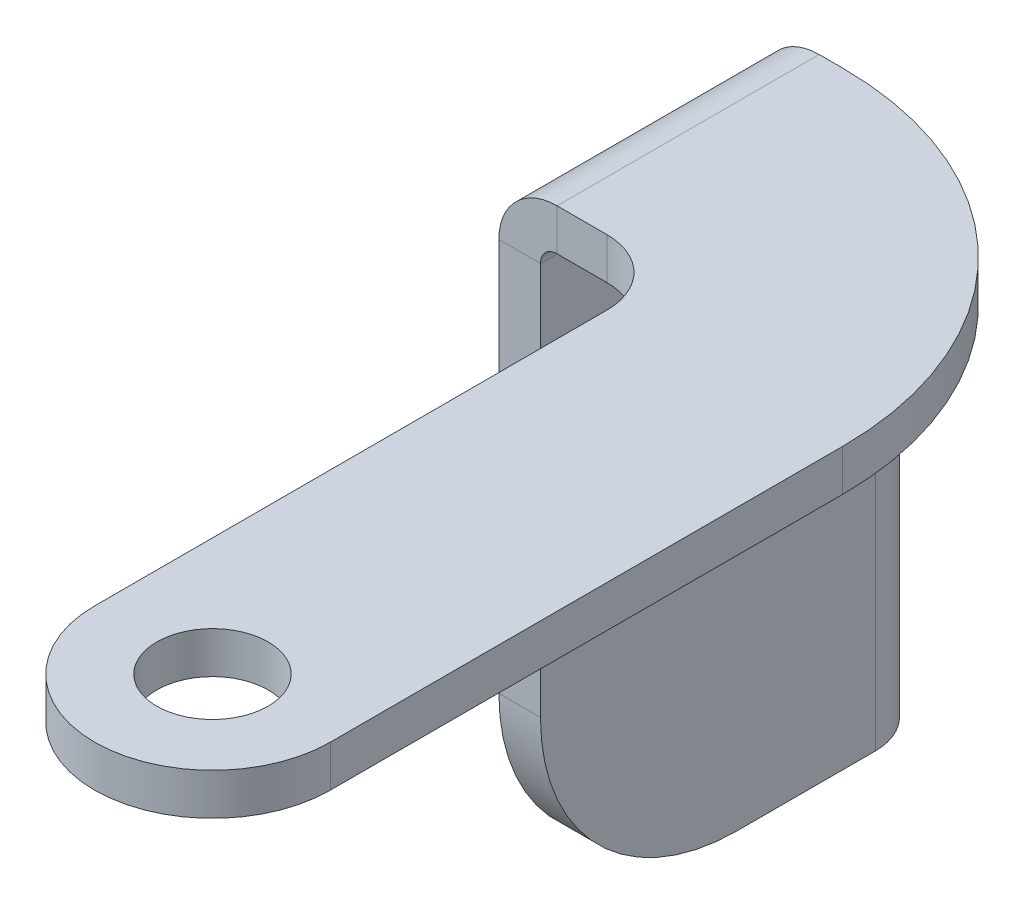
from build123d import *

# Parameters (mm, degrees)
SKETCH1_R                    = 4.25
BASE_FLANGE1_DEPTH           = 3.175
EDGE_FLANGE1_DEPTH           = 20
EDGE_FLANGE1_START           = 3.175
EDGE_FLANGE1_FLAT_DEPTH      = 3.175
EDGE_FLANGE3_STRIP_W         = 15.24
EDGE_FLANGE3_STRIP_H         = 3.175
EDGE_FLANGE3_STRIP_CUT_DEPTH = 20
EDGE_FLANGE3_DEPTH           = 20
EDGE_FLANGE3_START           = -3.175
EDGE_FLANGE3_PROFILE_R       = 4.25
EDGE_FLANGE3_FLAT_DEPTH      = 3.175


# Sheet-metal steps are written as plain solids
with BuildPart() as part:
    # Sketch1 → Base-Flange1 (new body)
    with BuildSketch(Plane.XY):
        with BuildLine():
            Line((12.5, 10), (0, 10))
            ThreePointArc((0, 10), (-10, 0), (0, -10))
            Line((0, -10), (12.5, -10))
            Line((12.5, -10), (12.5, 10))
        make_face()
        Circle(SKETCH1_R, mode=Mode.SUBTRACT)
    extrude(amount=-BASE_FLANGE1_DEPTH)

    # Edge-Flange1 bend section (across the edge) → Edge-Flange1 (add)
    with BuildSketch(Plane(origin=(13.77, -10, 0), x_dir=(-1, 0, 0), z_dir=(0, 1, 0))):
        with BuildLine():
            Line((-3.175, 1.27), (0, 1.27))
            ThreePointArc((0, 1.27), (0.371974388, 0.371974388), (1.27, 0))
            Line((1.27, 0), (1.27, -3.175))
            ThreePointArc((1.27, -3.175), (-1.873089642, -1.873089642), (-3.175, 1.27))
        make_face()
    extrude(amount=EDGE_FLANGE1_DEPTH)

    # Edge-Flange1 profile (on flange) → Edge-Flange1 flat (add)
    with BuildSketch(Plane.YZ.offset(13.77).offset(EDGE_FLANGE1_START)):
        with BuildLine():
            Line((36.2752, 26.825), (5, 26.825))
            ThreePointArc((5, 26.825), (-5.606601718, 22.431601718), (-10, 11.825))
            Line((-10, 11.825), (-10, 1.27))
            Line((-10, 1.27), (10, 1.27))
            Line((10, 1.27), (10, 1.825))
            ThreePointArc((10, 1.825), (11.464466094, 5.360533906), (15, 6.825))
            Line((15, 6.825), (36.2752, 6.825))
            Line((36.2752, 6.825), (36.2752, 26.825))
        make_face()
    extrude(amount=-EDGE_FLANGE1_FLAT_DEPTH)

    # Edge-Flange3 strip (across the edge) → Edge-Flange3 strip cut (cut)
    with BuildSketch(Plane(origin=(16.945, 36.2752, 6.825), x_dir=(0, -1, 0), z_dir=(0, 0, 1))):
        with Locations((-6.35, -1.5875)):
            Rectangle(EDGE_FLANGE3_STRIP_W, EDGE_FLANGE3_STRIP_H)
    extrude(amount=EDGE_FLANGE3_STRIP_CUT_DEPTH, mode=Mode.SUBTRACT)

    # Edge-Flange3 bend section (across the edge) → Edge-Flange3 (add)
    with BuildSketch(Plane(origin=(16.945, 36.2752, 6.825), x_dir=(0, -1, 0), z_dir=(0, 0, 1))):
        with BuildLine():
            Line((-3.175, 1.27), (0, 1.27))
            ThreePointArc((0, 1.27), (0.371974388, 0.371974388), (1.27, 0))
            Line((1.27, 0), (1.27, -3.175))
            ThreePointArc((1.27, -3.175), (-1.873089642, -1.873089642), (-3.175, 1.27))
        make_face()
    extrude(amount=EDGE_FLANGE3_DEPTH)

    # Edge-Flange3 profile (on flange) → Edge-Flange3 flat (add)
    with BuildSketch(Plane(origin=(16.945, 36.2752, 0), x_dir=(0, 0, -1), z_dir=(0, -1, 0)).offset(EDGE_FLANGE3_START)):
        with BuildLine():
            ThreePointArc((-6.825, 3.0675), (-14.14733047, 20.74516953), (-31.825, 28.0675))
            Line((-31.825, 28.0675), (-70.925400974, 28.0675))
            ThreePointArc((-70.925400974, 28.0675), (-79.925400974, 19.0675), (-70.925400974, 10.0675))
            Line((-70.925400974, 10.0675), (-31.825, 10.0675))
            ThreePointArc((-31.825, 10.0675), (-28.289466094, 8.603033906), (-26.825, 5.0675))
            Line((-26.825, 5.0675), (-26.825, 1.27))
            Line((-26.825, 1.27), (-6.825, 1.27))
            Line((-6.825, 1.27), (-6.825, 3.0675))
        make_face()
        with Locations((-70.925400974, 19.0675)):
            Circle(EDGE_FLANGE3_PROFILE_R, mode=Mode.SUBTRACT)
    extrude(amount=EDGE_FLANGE3_FLAT_DEPTH)


solid = part.part
